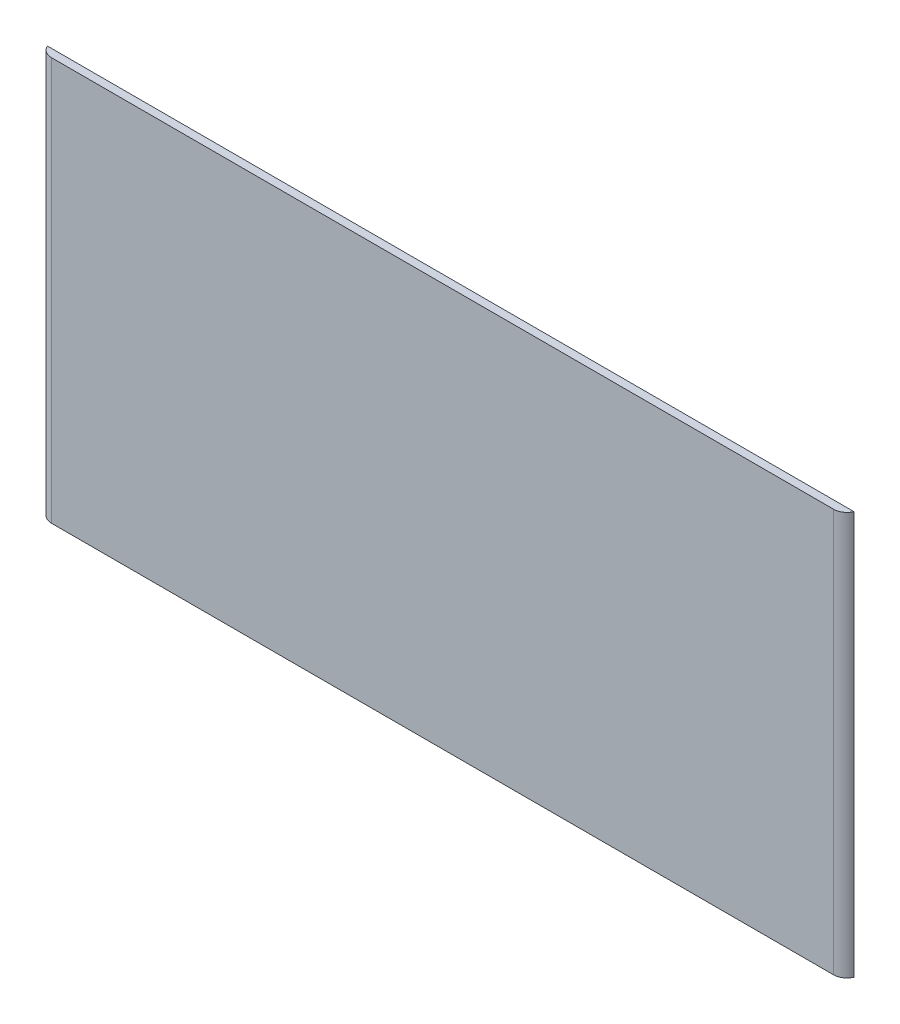
from build123d import *

# Parameters (mm, degrees)
ESBO_O1_W                = 600
ESBO_O1_H                = 300
RESSALTO_EXTRUS_O2_DEPTH = 6
FILETE1_R                = 10
FILETE2_R                = 10


with BuildPart() as part:
    # Esboço1 → Ressalto-extrusão2 (new body)
    with BuildSketch(Plane.XY):
        with Locations((300, -150)):
            Rectangle(ESBO_O1_W, ESBO_O1_H)
    extrude(amount=RESSALTO_EXTRUS_O2_DEPTH)

    # Filete1
    # the kernel refuses this fillet: 10 mm, written as the material it takes off along each edge
    with BuildSketch(Plane(origin=(600, 22.912878475, 6), x_dir=(0, 0, -1), z_dir=(0, -1, 0))) as filete1_piece_1:
        with BuildLine():
            CenterArc((10, -9.16515139), FILETE1_R, 113.578178478, 66.421821522)
            Line((0, -9.16515139), (-0.2, -9.16515139))
            Line((-0.2, -9.16515139), (-0.2, 0))
            Line((-0.2, 0), (0, 0.2))
            ThreePointArc((0, 0.2), (3, 0.2), (5.92, 0.183303028))
            Line((5.92, 0.183303028), (6, 0))
        make_face()
    extrude(amount=345.82575695, mode=Mode.SUBTRACT)

    # Filete2
    # the kernel refuses this fillet: 10 mm, written as the material it takes off along each edge
    with BuildSketch(Plane(origin=(0, -322.912878475, 6), x_dir=(1, 0, 0), z_dir=(0, 1, 0))) as filete2_piece_1:
        with BuildLine():
            CenterArc((9.16515139, 10), FILETE2_R, 203.578178478, 66.421821522)
            Line((0, 6), (-0.183303028, 5.92))
            ThreePointArc((-0.183303028, 5.92), (-0.2, 3), (-0.2, 0))
            Line((-0.2, 0), (0, -0.2))
            Line((0, -0.2), (9.16515139, -0.2))
            Line((9.16515139, -0.2), (9.16515139, 0))
        make_face()
    extrude(amount=345.82575695, mode=Mode.SUBTRACT)


solid = part.part
